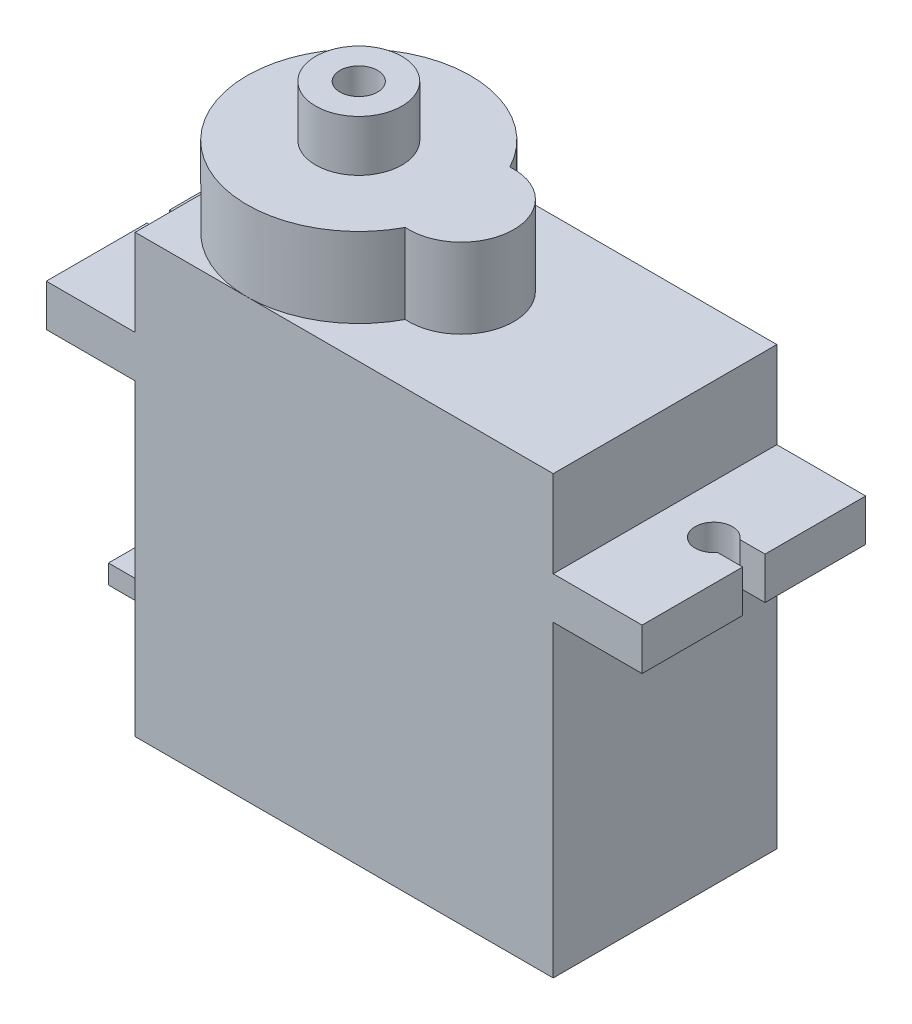
from build123d import *

# Parameters (mm, degrees)
SKETCH1_W                    = 22.7711
SKETCH1_H                    = 12.18
BOSS_EXTRUDE1_DEPTH          = 23.79
SKETCH3_W                    = 32.4485
SKETCH3_H                    = 12.18
BOSS_EXTRUDE2_DEPTH          = 2.286
CUT_EXTRUDE1_DEPTH           = 36.695245613
BOSS_EXTRUDE3_DEPTH          = 4.3434
SKETCH6_R                    = 2.3495
BOSS_EXTRUDE4_DEPTH          = 2.7813
SKETCH7_W                    = 2.8956
SKETCH7_H                    = 1.0414
BOSS_EXTRUDE5_DEPTH          = 6.096
M2_5X0_45_TAPPED_HOLE1_D     = 2.05
M2_5X0_45_TAPPED_HOLE1_DEPTH = 4
M2_5X0_45_TAPPED_HOLE1_TIP   = 0.615882135


with BuildPart() as part:
    # Sketch1 → Boss-Extrude1 (new body)
    with BuildSketch(Plane(origin=(0, 0, 0), x_dir=(1, 0, 0), z_dir=(0, 1, 0))):
        with Locations((11.38555, 6.09)):
            Rectangle(SKETCH1_W, SKETCH1_H)
    extrude(amount=BOSS_EXTRUDE1_DEPTH)

    # Sketch3 → Boss-Extrude2 (add)
    with BuildSketch(Plane(origin=(0, 19.0656, 0), x_dir=(1, 0, 0), z_dir=(0, 1, 0))):
        with Locations((11.38555, 6.09)):
            Rectangle(SKETCH3_W, SKETCH3_H)
    extrude(amount=-BOSS_EXTRUDE2_DEPTH)

    # Sketch4 → Cut-Extrude1 (cut, through all)
    with BuildSketch(Plane(origin=(0, 19.0656, 0), x_dir=(1, 0, 0), z_dir=(0, 1, 0))):
        with BuildLine():
            Line((-4.8387, 6.6996), (-3.4671, 6.6996))
            ThreePointArc((-3.4671, 6.6996), (-1.6383, 6.09), (-3.4671, 5.4804))
            Line((-3.4671, 5.4804), (-4.8387, 5.4804))
            Line((-4.8387, 5.4804), (-4.8387, 6.6996))
        make_face()
        with BuildLine():
            Line((26.2382, 5.4804), (27.6098, 5.4804))
            Line((27.6098, 5.4804), (27.6098, 6.6996))
            Line((27.6098, 6.6996), (26.2382, 6.6996))
            ThreePointArc((26.2382, 6.6996), (24.4094, 6.09), (26.2382, 5.4804))
        make_face()
    extrude(amount=-CUT_EXTRUDE1_DEPTH, mode=Mode.SUBTRACT)

    # Sketch5 → Boss-Extrude3 (add)
    with BuildSketch(Plane(origin=(0, 23.79, 0), x_dir=(1, 0, 0), z_dir=(0, 1, 0))):
        with BuildLine():
            ThreePointArc((11.471694537, 8.940519937), (0, 6.09), (11.471694537, 3.239480063))
            ThreePointArc((11.471694537, 3.239480063), (14.5288, 6.09), (11.471694537, 8.940519937))
        make_face()
    extrude(amount=BOSS_EXTRUDE3_DEPTH)

    # Sketch6 → Boss-Extrude4 (add)
    with BuildSketch(Plane(origin=(0, 28.1334, 0), x_dir=(1, 0, 0), z_dir=(0, 1, 0))):
        with Locations((6.09, 6.09)):
            Circle(SKETCH6_R)
    extrude(amount=BOSS_EXTRUDE4_DEPTH)

    # Sketch7 → Boss-Extrude5 (add)
    with BuildSketch(Plane.ZY):
        with Locations((-6.09, 2.3007)):
            Rectangle(SKETCH7_W, SKETCH7_H)
    extrude(amount=BOSS_EXTRUDE5_DEPTH)

    # M2.5x0.45 Tapped Hole1
    with Locations(Plane(origin=(0, 30.9147, 0), x_dir=(1, 0, 0), z_dir=(0, 1, 0))):
        with Locations((6.09, 6.09)):
            Hole(M2_5X0_45_TAPPED_HOLE1_D / 2, depth=M2_5X0_45_TAPPED_HOLE1_DEPTH)
            with Locations((0, 0, -(M2_5X0_45_TAPPED_HOLE1_DEPTH + M2_5X0_45_TAPPED_HOLE1_TIP / 2))):  # 118° drill point
                Cone(0, M2_5X0_45_TAPPED_HOLE1_D / 2, M2_5X0_45_TAPPED_HOLE1_TIP, mode=Mode.SUBTRACT)


solid = part.part
